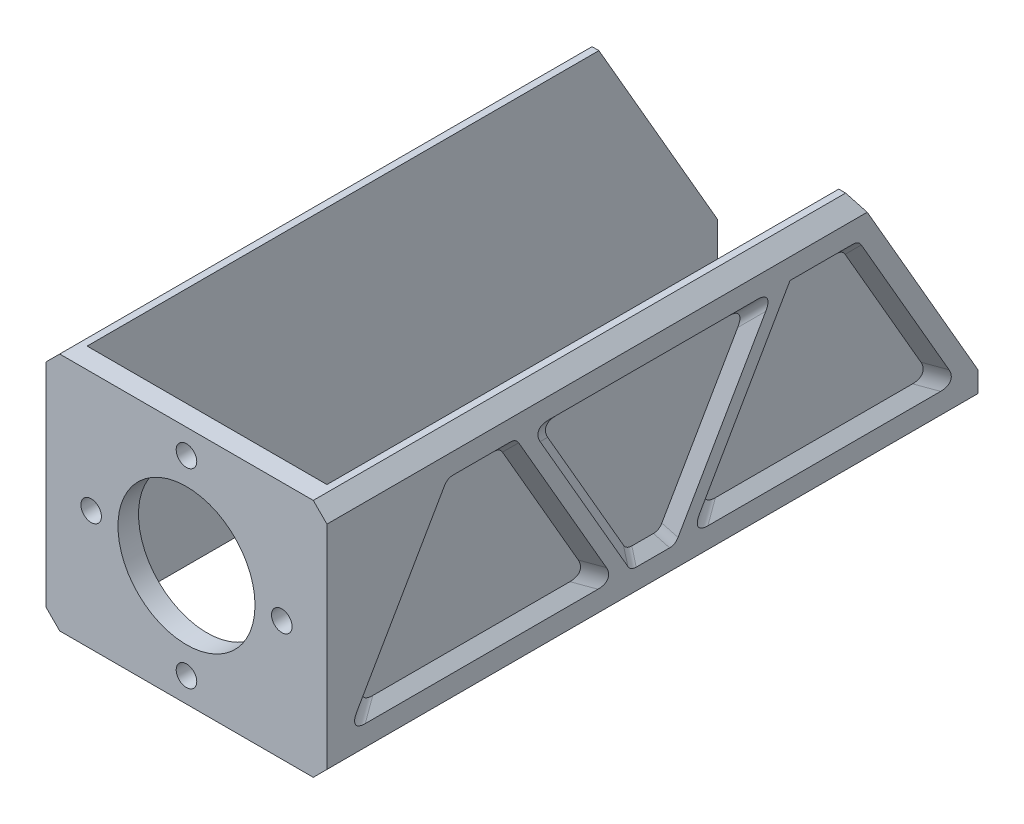
from build123d import *

# Parameters (mm, degrees)
SKETCH1_W           = 35
SKETCH1_H           = 35
BOSS_EXTRUDE1_DEPTH = 3
SKETCH2_R           = 10
CUT_EXTRUDE1_DEPTH  = 50.588305073
SKETCH4_W           = 95
SKETCH4_H           = 35
BOSS_EXTRUDE2_DEPTH = 3
SKETCH6_W           = 95
SKETCH6_H           = 35
BOSS_EXTRUDE5_DEPTH = 3
CHAMFER1_SIZE       = 2
CUT_EXTRUDE3_DEPTH  = 1.5
CUT_EXTRUDE4_DEPTH  = 1.5
CUT_EXTRUDE5_DEPTH  = 1.5
CHAMFER3_SIZE       = 1.5
CUT_EXTRUDE6_DEPTH  = 107.630202101
SKETCH11_R          = 1.5
CUT_EXTRUDE7_DEPTH  = 109.138799697
FILLET3_R           = 2


# Some blends are built 0.0001 mm under size
with BuildPart() as part:
    # Sketch1 → Boss-Extrude1 (new body)
    with BuildSketch(Plane.XY):
        with Locations((17.5, 17.5)):
            Rectangle(SKETCH1_W, SKETCH1_H)
    extrude(amount=BOSS_EXTRUDE1_DEPTH)

    # Sketch2 → Cut-Extrude1 (cut, through all)
    with BuildSketch(Plane.XY.offset(3)):
        with Locations((17.5, 17.5)):
            Circle(SKETCH2_R)
    extrude(amount=-CUT_EXTRUDE1_DEPTH, mode=Mode.SUBTRACT)

    # Sketch4 → Boss-Extrude2 (add)
    with BuildSketch(Plane.ZY):
        with Locations((-44.5, 17.5)):
            Rectangle(SKETCH4_W, SKETCH4_H)
    extrude(amount=BOSS_EXTRUDE2_DEPTH)

    # Sketch6 → Boss-Extrude5 (add)
    with BuildSketch(Plane(origin=(35, 0, 0), x_dir=(0, 0, -1), z_dir=(1, 0, 0))):
        with Locations((44.5, 17.5)):
            Rectangle(SKETCH6_W, SKETCH6_H)
    extrude(amount=BOSS_EXTRUDE5_DEPTH)

    # Chamfer1
    chamfer1_edges = [part.edges().sort_by_distance(p)[0] for p in [
        (-3, 35, -44.5),
        (-3, 0, -44.5),
        (38, 0, -44.5),
        (38, 35, -44.5),
    ]]
    chamfer(chamfer1_edges, length=CHAMFER1_SIZE)

    # Sketch7 → Cut-Extrude3 (cut)
    with BuildSketch(Plane.ZY.offset(3)):
        Polygon((-89, 5), (-50.132486541, 5), (-64.56624327, 30), (-74.56624327, 30), align=None)
        Polygon((-39, 5), (-24.56624327, 30), (-14.56624327, 30), (-0.132486541, 5), align=None)
    extrude(amount=-CUT_EXTRUDE3_DEPTH, mode=Mode.SUBTRACT)

    # Sketch8 → Cut-Extrude4 (cut)
    with BuildSketch(Plane.ZY.offset(3)):
        Polygon((-47.823085464, 5), (-41.309401077, 5), (-26.875644347, 30), (-62.256842194, 30), align=None)
    extrude(amount=-CUT_EXTRUDE4_DEPTH, mode=Mode.SUBTRACT)

    # Sketch9 → Cut-Extrude5 (cut)
    with BuildSketch(Plane(origin=(38, 0, 0), x_dir=(0, 0, -1), z_dir=(1, 0, 0))):
        Polygon((0.132486541, 5), (14.56624327, 30), (24.56624327, 30), (39, 5), align=None)
        Polygon((41.309401077, 5), (47.823085464, 5), (62.256842194, 30), (26.875644347, 30), align=None)
        Polygon((50.132486541, 5), (89, 5), (74.56624327, 30), (64.56624327, 30), align=None)
    extrude(amount=-CUT_EXTRUDE5_DEPTH, mode=Mode.SUBTRACT)

    # Chamfer3
    chamfer3_edges = [part.edges().sort_by_distance(p)[0] for p in [
        (-1.5, 17.5, -31.783121635),
        (-1.5, 30, -19.56624327),
        (-1.5, 17.5, -7.349364905),
        (-1.5, 5, -19.56624327),
        (-1.5, 30, -44.56624327),
        (-1.5, 17.5, -34.092522712),
        (-1.5, 5, -44.56624327),
        (-1.5, 17.5, -55.039963829),
        (-1.5, 30, -69.56624327),
        (-1.5, 17.5, -57.349364905),
        (-1.5, 5, -69.56624327),
        (-1.5, 17.5, -81.783121635),
        (36.5, 30, -69.56624327),
        (36.5, 17.5, -81.783121635),
        (36.5, 5, -69.56624327),
        (36.5, 17.5, -57.349364905),
        (36.5, 30, -44.56624327),
        (36.5, 17.5, -55.039963829),
        (36.5, 5, -44.56624327),
        (36.5, 17.5, -34.092522712),
        (36.5, 17.5, -7.349364905),
        (36.5, 30, -19.56624327),
        (36.5, 17.5, -31.783121635),
        (36.5, 5, -19.56624327),
    ]]
    chamfer(chamfer3_edges, length=CHAMFER3_SIZE - 0.0001)  # a hair under: the kernel refuses the full size

    # Sketch10 → Cut-Extrude6 (cut, through all)
    with BuildSketch(Plane.ZY.offset(3)):
        Polygon((-92, 5), (-74.679491924, 35), (-92, 35), align=None)
    extrude(amount=-CUT_EXTRUDE6_DEPTH, mode=Mode.SUBTRACT)

    # Sketch11 → Cut-Extrude7 (cut, through all)
    with BuildSketch(Plane.XY.offset(3)):
        with Locations((17.5, 31.41)):
            Circle(SKETCH11_R)
        with Locations((31.41, 17.5)):
            Circle(SKETCH11_R)
        with Locations((17.5, 3.59)):
            Circle(SKETCH11_R)
        with Locations((3.59, 17.5)):
            Circle(SKETCH11_R)
    extrude(amount=-CUT_EXTRUDE7_DEPTH, mode=Mode.SUBTRACT)

    # Fillet3
    # the kernel refuses this fillet: 2 mm, written as the material it adds along each edge
    with BuildSketch(Plane(origin=(-4.237079148, 31.237179148, -13.851957556), x_dir=(-0.26726124191242534, -0.6681531047810635, 0.6943650748294108), z_dir=(0.6546536707079771, -0.6546536707079762, -0.37796447300922925))) as fillet3_piece_1_section:
        with BuildLine():
            CenterArc((FILLET3_R * 0.377964473009, FILLET3_R), FILLET3_R, 228.590377891, 41.409622109)
            Line((-FILLET3_R * 0.283473354757, FILLET3_R * 0.25), (0, 0))
            Line((0, 0), (FILLET3_R * 0.377964473009, 0))
        make_face()
    fillet3_piece_1 = extrude(amount=6.070779825, mode=Mode.PRIVATE)
    fillet3_piece_1 = split(fillet3_piece_1, bisect_by=Plane(origin=(-3, 30.0000375, -14.56622162), z_dir=(1, 0, 0)), keep=Keep.TOP, mode=Mode.PRIVATE)
    add(fillet3_piece_1)
    with BuildSketch(Plane(origin=(-4.731950808, 3.267949192, 2.867513459), x_dir=(-0.5477225575051657, -0.5477225575051657, -0.6324555320336765), z_dir=(0.4472135954999585, 0.4472135954999585, -0.7745966692414828))) as fillet3_piece_2_section:
        with BuildLine():
            CenterArc((FILLET3_R * 0.774596669241, FILLET3_R), FILLET3_R, 194.477512186, 75.522487814)
            Line((-FILLET3_R * 0.19364916731, FILLET3_R * 0.75), (0, 0))
            Line((0, 0), (FILLET3_R * 0.774596669241, 0))
        make_face()
    fillet3_piece_2 = extrude(amount=11.099845052, mode=Mode.PRIVATE)
    fillet3_piece_2 = split(fillet3_piece_2, bisect_by=Plane(origin=(-3, 6.208026651, -2.224850076), z_dir=(1, 0, 0)), keep=Keep.TOP, mode=Mode.PRIVATE)
    fillet3_piece_2 = split(fillet3_piece_2, bisect_by=Plane(origin=(-1.5, 6.208026651, -2.224850076), z_dir=(-1, 0, 0)), keep=Keep.TOP, mode=Mode.PRIVATE)
    add(fillet3_piece_2)
    with BuildSketch(Plane(origin=(-4.237079148, 31.237179148, -25.280528985), x_dir=(-0.2672612419124285, -0.6681531047810648, -0.6943650748294081), z_dir=(0.6546536707079759, -0.6546536707079768, 0.3779644730092301))) as fillet3_piece_3_section:
        with BuildLine():
            CenterArc((FILLET3_R * 0.377964473009, -FILLET3_R), FILLET3_R, 90, 41.409622109)
            Line((-FILLET3_R * 0.283473354757, -FILLET3_R * 0.25), (0, 0))
            Line((0, 0), (FILLET3_R * 0.377964473009, 0))
        make_face()
    fillet3_piece_3 = extrude(amount=6.070779825, mode=Mode.PRIVATE)
    fillet3_piece_3 = split(fillet3_piece_3, bisect_by=Plane(origin=(-3, 30.0000375, -24.566264921), z_dir=(1, 0, 0)), keep=Keep.TOP, mode=Mode.PRIVATE)
    add(fillet3_piece_3)
    with BuildSketch(Plane(origin=(-4.731950808, 3.267949192, -42), x_dir=(-0.5477225575051646, -0.5477225575051644, 0.6324555320336788), z_dir=(0.44721359549996004, 0.44721359549996004, 0.7745966692414811))) as fillet3_piece_4_section:
        with BuildLine():
            CenterArc((FILLET3_R * 0.774596669241, -FILLET3_R), FILLET3_R, 90, 75.522487814)
            Line((-FILLET3_R * 0.19364916731, -FILLET3_R * 0.75), (0, 0))
            Line((0, 0), (FILLET3_R * 0.774596669241, 0))
        make_face()
    fillet3_piece_4 = extrude(amount=11.099845052, mode=Mode.PRIVATE)
    fillet3_piece_4 = split(fillet3_piece_4, bisect_by=Plane(origin=(-3, 6.208026651, -36.907636464), z_dir=(1, 0, 0)), keep=Keep.TOP, mode=Mode.PRIVATE)
    fillet3_piece_4 = split(fillet3_piece_4, bisect_by=Plane(origin=(-1.5, 6.208026651, -36.907636464), z_dir=(-1, 0, 0)), keep=Keep.TOP, mode=Mode.PRIVATE)
    add(fillet3_piece_4)
    with BuildSketch(Plane(origin=(-4.237079148, 3.762820852, -40.595115362), x_dir=(-0.26726124191242456, -0.26726124191242456, -0.9258200997725514), z_dir=(0.6546536707079772, 0.6546536707079771, -0.3779644730092275))) as fillet3_piece_5_section:
        with BuildLine():
            CenterArc((FILLET3_R * 0.377964473009, FILLET3_R), FILLET3_R, 228.590377891, 41.409622109)
            Line((-FILLET3_R * 0.283473354757, FILLET3_R * 0.25), (0, 0))
            Line((0, 0), (FILLET3_R * 0.377964473009, 0))
        make_face()
    fillet3_piece_5 = extrude(amount=6.070779825, mode=Mode.PRIVATE)
    fillet3_piece_5 = split(fillet3_piece_5, bisect_by=Plane(origin=(-3, 4.9999625, -41.309379426), z_dir=(1, 0, 0)), keep=Keep.TOP, mode=Mode.PRIVATE)
    add(fillet3_piece_5)
    with BuildSketch(Plane(origin=(-4.237079148, 3.762820852, -48.537371178), x_dir=(-0.26726124191242456, -0.267261241912424, 0.9258200997725515), z_dir=(0.6546536707079772, 0.6546536707079773, 0.37796447300922714))) as fillet3_piece_6_section:
        with BuildLine():
            CenterArc((FILLET3_R * 0.377964473009, -FILLET3_R), FILLET3_R, 90, 41.409622109)
            Line((-FILLET3_R * 0.283473354757, -FILLET3_R * 0.25), (0, 0))
            Line((0, 0), (FILLET3_R * 0.377964473009, 0))
        make_face()
    fillet3_piece_6 = extrude(amount=6.070779825, mode=Mode.PRIVATE)
    fillet3_piece_6 = split(fillet3_piece_6, bisect_by=Plane(origin=(-3, 4.9999625, -47.823107114), z_dir=(1, 0, 0)), keep=Keep.TOP, mode=Mode.PRIVATE)
    add(fillet3_piece_6)
    with BuildSketch(Plane(origin=(-4.731950808, 31.732050808, -23.875644347), x_dir=(-0.5477225575051662, -0.8215838362577491, 0.1581138830084191), z_dir=(0.44721359549995787, -0.44721359549995815, -0.7745966692414833))) as fillet3_piece_7_section:
        with BuildLine():
            CenterArc((FILLET3_R * 0.774596669241, FILLET3_R), FILLET3_R, 194.477512186, 75.522487814)
            Line((-FILLET3_R * 0.19364916731, FILLET3_R * 0.75), (0, 0))
            Line((0, 0), (FILLET3_R * 0.774596669241, 0))
        make_face()
    fillet3_piece_7 = extrude(amount=11.099845052, mode=Mode.PRIVATE)
    fillet3_piece_7 = split(fillet3_piece_7, bisect_by=Plane(origin=(-3, 28.791973349, -28.968007883), z_dir=(1, 0, 0)), keep=Keep.TOP, mode=Mode.PRIVATE)
    fillet3_piece_7 = split(fillet3_piece_7, bisect_by=Plane(origin=(0, 28.791973349, -28.968007883), z_dir=(-1, 0, 0)), keep=Keep.TOP, mode=Mode.PRIVATE)
    add(fillet3_piece_7)
    with BuildSketch(Plane(origin=(-4.731950808, 31.732050808, -65.256842194), x_dir=(-0.5477225575051665, -0.821583836257749, -0.15811388300841855), z_dir=(0.4472135954999584, -0.44721359549995815, 0.7745966692414831))) as fillet3_piece_8_section:
        with BuildLine():
            CenterArc((FILLET3_R * 0.774596669241, -FILLET3_R), FILLET3_R, 90, 75.522487814)
            Line((-FILLET3_R * 0.19364916731, -FILLET3_R * 0.75), (0, 0))
            Line((0, 0), (FILLET3_R * 0.774596669241, 0))
        make_face()
    fillet3_piece_8 = extrude(amount=11.099845052, mode=Mode.PRIVATE)
    fillet3_piece_8 = split(fillet3_piece_8, bisect_by=Plane(origin=(-3, 28.791973349, -60.164478658), z_dir=(1, 0, 0)), keep=Keep.TOP, mode=Mode.PRIVATE)
    fillet3_piece_8 = split(fillet3_piece_8, bisect_by=Plane(origin=(0, 28.791973349, -60.164478658), z_dir=(-1, 0, 0)), keep=Keep.TOP, mode=Mode.PRIVATE)
    add(fillet3_piece_8)
    with BuildSketch(Plane(origin=(-4.731950808, 3.267949192, -47.132486541), x_dir=(-0.5477225575051652, -0.5477225575051655, -0.6324555320336772), z_dir=(0.4472135954999589, 0.447213595499959, -0.7745966692414823))) as fillet3_piece_9_section:
        with BuildLine():
            CenterArc((FILLET3_R * 0.774596669241, FILLET3_R), FILLET3_R, 194.477512186, 75.522487814)
            Line((-FILLET3_R * 0.19364916731, FILLET3_R * 0.75), (0, 0))
            Line((0, 0), (FILLET3_R * 0.774596669241, 0))
        make_face()
    fillet3_piece_9 = extrude(amount=11.099845052, mode=Mode.PRIVATE)
    fillet3_piece_9 = split(fillet3_piece_9, bisect_by=Plane(origin=(-3, 6.208026651, -52.224850076), z_dir=(1, 0, 0)), keep=Keep.TOP, mode=Mode.PRIVATE)
    fillet3_piece_9 = split(fillet3_piece_9, bisect_by=Plane(origin=(-1.5, 6.208026651, -52.224850076), z_dir=(-1, 0, 0)), keep=Keep.TOP, mode=Mode.PRIVATE)
    add(fillet3_piece_9)
    with BuildSketch(Plane(origin=(-4.731950808, 3.267949192, -92), x_dir=(-0.5477225575051636, -0.5477225575051639, 0.63245553203368), z_dir=(0.4472135954999609, 0.44721359549996087, 0.7745966692414801))) as fillet3_piece_10_section:
        with BuildLine():
            CenterArc((FILLET3_R * 0.774596669241, -FILLET3_R), FILLET3_R, 90, 75.522487814)
            Line((-FILLET3_R * 0.19364916731, -FILLET3_R * 0.75), (0, 0))
            Line((0, 0), (FILLET3_R * 0.774596669241, 0))
        make_face()
    fillet3_piece_10 = extrude(amount=11.099845052, mode=Mode.PRIVATE)
    fillet3_piece_10 = split(fillet3_piece_10, bisect_by=Plane(origin=(-3, 6.208026651, -86.907636464), z_dir=(1, 0, 0)), keep=Keep.TOP, mode=Mode.PRIVATE)
    fillet3_piece_10 = split(fillet3_piece_10, bisect_by=Plane(origin=(-1.5, 6.208026651, -86.907636464), z_dir=(-1, 0, 0)), keep=Keep.TOP, mode=Mode.PRIVATE)
    add(fillet3_piece_10)
    with BuildSketch(Plane(origin=(-4.237079148, 31.237179148, -63.851957556), x_dir=(-0.2672612419124199, -0.6681531047810638, 0.6943650748294127), z_dir=(0.6546536707079784, -0.6546536707079738, -0.377964473009231))) as fillet3_piece_11_section:
        with BuildLine():
            CenterArc((FILLET3_R * 0.377964473009, FILLET3_R), FILLET3_R, 228.590377891, 41.409622109)
            Line((-FILLET3_R * 0.283473354757, FILLET3_R * 0.25), (0, 0))
            Line((0, 0), (FILLET3_R * 0.377964473009, 0))
        make_face()
    fillet3_piece_11 = extrude(amount=6.070779825, mode=Mode.PRIVATE)
    fillet3_piece_11 = split(fillet3_piece_11, bisect_by=Plane(origin=(-3, 30.0000375, -64.56622162), z_dir=(1, 0, 0)), keep=Keep.TOP, mode=Mode.PRIVATE)
    add(fillet3_piece_11)
    with BuildSketch(Plane(origin=(-4.237079148, 31.237179148, -75.280528985), x_dir=(-0.2672612419124319, -0.6681531047810608, -0.6943650748294108), z_dir=(0.6546536707079755, -0.6546536707079802, 0.37796447300922503))) as fillet3_piece_12_section:
        with BuildLine():
            CenterArc((FILLET3_R * 0.377964473009, -FILLET3_R), FILLET3_R, 90, 41.409622109)
            Line((-FILLET3_R * 0.283473354757, -FILLET3_R * 0.25), (0, 0))
            Line((0, 0), (FILLET3_R * 0.377964473009, 0))
        make_face()
    fillet3_piece_12 = extrude(amount=6.070779825, mode=Mode.PRIVATE)
    fillet3_piece_12 = split(fillet3_piece_12, bisect_by=Plane(origin=(-3, 30.0000375, -74.566264921), z_dir=(1, 0, 0)), keep=Keep.TOP, mode=Mode.PRIVATE)
    add(fillet3_piece_12)
    with BuildSketch(Plane(origin=(39.731950808, 3.267949192, -92), x_dir=(0.547722557505162, -0.5477225575051657, 0.6324555320336798), z_dir=(-0.44721359549996026, 0.44721359549996115, 0.7745966692414803))) as fillet3_piece_13_section:
        with BuildLine():
            CenterArc((FILLET3_R * 0.774596669241, FILLET3_R), FILLET3_R, 194.477512186, 75.522487814)
            Line((-FILLET3_R * 0.19364916731, FILLET3_R * 0.75), (0, 0))
            Line((0, 0), (FILLET3_R * 0.774596669241, 0))
        make_face()
    fillet3_piece_13 = extrude(amount=11.099845052, mode=Mode.PRIVATE)
    fillet3_piece_13 = split(fillet3_piece_13, bisect_by=Plane(origin=(38, 6.208026651, -86.907636464), z_dir=(-1, 0, 0)), keep=Keep.TOP, mode=Mode.PRIVATE)
    fillet3_piece_13 = split(fillet3_piece_13, bisect_by=Plane(origin=(36.5, 6.208026651, -86.907636464), z_dir=(1, 0, 0)), keep=Keep.TOP, mode=Mode.PRIVATE)
    add(fillet3_piece_13)
    with BuildSketch(Plane(origin=(39.731950808, 3.267949192, -47.132486541), x_dir=(0.5477225575051635, 0.8215838362577502, 0.15811388300842216), z_dir=(-0.4472135954999577, 0.44721359549995876, -0.7745966692414832))) as fillet3_piece_14_section:
        with BuildLine():
            CenterArc((FILLET3_R * 0.774596669241, FILLET3_R), FILLET3_R, 194.477512186, 75.522487814)
            Line((-FILLET3_R * 0.19364916731, FILLET3_R * 0.75), (0, 0))
            Line((0, 0), (FILLET3_R * 0.774596669241, 0))
        make_face()
    fillet3_piece_14 = extrude(amount=11.099845052, mode=Mode.PRIVATE)
    fillet3_piece_14 = split(fillet3_piece_14, bisect_by=Plane(origin=(38, 6.208026651, -52.224850076), z_dir=(-1, 0, 0)), keep=Keep.TOP, mode=Mode.PRIVATE)
    fillet3_piece_14 = split(fillet3_piece_14, bisect_by=Plane(origin=(36.5, 6.208026651, -52.224850076), z_dir=(1, 0, 0)), keep=Keep.TOP, mode=Mode.PRIVATE)
    add(fillet3_piece_14)
    with BuildSketch(Plane(origin=(39.237079148, 31.237179148, -75.280528985), x_dir=(0.2672612419124258, 0.26726124191242107, 0.9258200997725521), z_dir=(-0.654653670707975, -0.6546536707079802, 0.3779644730092258))) as fillet3_piece_15_section:
        with BuildLine():
            CenterArc((FILLET3_R * 0.377964473009, -FILLET3_R), FILLET3_R, 90, 41.409622109)
            Line((-FILLET3_R * 0.283473354757, -FILLET3_R * 0.25), (0, 0))
            Line((0, 0), (FILLET3_R * 0.377964473009, 0))
        make_face()
    fillet3_piece_15 = extrude(amount=6.070779825, mode=Mode.PRIVATE)
    fillet3_piece_15 = split(fillet3_piece_15, bisect_by=Plane(origin=(38, 30.0000375, -74.566264921), z_dir=(-1, 0, 0)), keep=Keep.TOP, mode=Mode.PRIVATE)
    add(fillet3_piece_15)
    with BuildSketch(Plane(origin=(39.237079148, 3.762820852, -48.537371178), x_dir=(0.26726124191242484, -0.26726124191242484, 0.9258200997725512), z_dir=(-0.6546536707079762, 0.6546536707079778, 0.37796447300922786))) as fillet3_piece_16_section:
        with BuildLine():
            CenterArc((FILLET3_R * 0.377964473009, FILLET3_R), FILLET3_R, 228.590377891, 41.409622109)
            Line((-FILLET3_R * 0.283473354757, FILLET3_R * 0.25), (0, 0))
            Line((0, 0), (FILLET3_R * 0.377964473009, 0))
        make_face()
    fillet3_piece_16 = extrude(amount=6.070779825, mode=Mode.PRIVATE)
    fillet3_piece_16 = split(fillet3_piece_16, bisect_by=Plane(origin=(38, 4.9999625, -47.823107114), z_dir=(-1, 0, 0)), keep=Keep.TOP, mode=Mode.PRIVATE)
    add(fillet3_piece_16)
    with BuildSketch(Plane(origin=(39.237079148, 3.762820852, -40.595115362), x_dir=(0.26726124191242373, 0.66815310478106, 0.6943650748294149), z_dir=(-0.6546536707079764, 0.6546536707079779, -0.37796447300922736))) as fillet3_piece_17_section:
        with BuildLine():
            CenterArc((FILLET3_R * 0.377964473009, FILLET3_R), FILLET3_R, 228.590377891, 41.409622109)
            Line((-FILLET3_R * 0.283473354757, FILLET3_R * 0.25), (0, 0))
            Line((0, 0), (FILLET3_R * 0.377964473009, 0))
        make_face()
    fillet3_piece_17 = extrude(amount=6.070779825, mode=Mode.PRIVATE)
    fillet3_piece_17 = split(fillet3_piece_17, bisect_by=Plane(origin=(38, 4.9999625, -41.309379426), z_dir=(-1, 0, 0)), keep=Keep.TOP, mode=Mode.PRIVATE)
    add(fillet3_piece_17)
    with BuildSketch(Plane(origin=(39.731950808, 31.732050808, -65.256842194), x_dir=(0.5477225575051664, 0.5477225575051664, 0.6324555320336754), z_dir=(-0.4472135954999572, -0.44721359549995804, 0.7745966692414837))) as fillet3_piece_18_section:
        with BuildLine():
            CenterArc((FILLET3_R * 0.774596669241, -FILLET3_R), FILLET3_R, 90, 75.522487814)
            Line((-FILLET3_R * 0.19364916731, -FILLET3_R * 0.75), (0, 0))
            Line((0, 0), (FILLET3_R * 0.774596669241, 0))
        make_face()
    fillet3_piece_18 = extrude(amount=11.099845052, mode=Mode.PRIVATE)
    fillet3_piece_18 = split(fillet3_piece_18, bisect_by=Plane(origin=(38, 28.791973349, -60.164478658), z_dir=(-1, 0, 0)), keep=Keep.TOP, mode=Mode.PRIVATE)
    fillet3_piece_18 = split(fillet3_piece_18, bisect_by=Plane(origin=(36.5, 28.791973349, -60.164478658), z_dir=(1, 0, 0)), keep=Keep.TOP, mode=Mode.PRIVATE)
    add(fillet3_piece_18)
    with BuildSketch(Plane(origin=(39.731950808, 31.732050808, -23.875644347), x_dir=(0.5477225575051664, -0.8215838362577489, 0.15811388300841975), z_dir=(-0.44721359549995715, -0.4472135954999585, -0.7745966692414836))) as fillet3_piece_19_section:
        with BuildLine():
            CenterArc((FILLET3_R * 0.774596669241, -FILLET3_R), FILLET3_R, 90, 75.522487814)
            Line((-FILLET3_R * 0.19364916731, -FILLET3_R * 0.75), (0, 0))
            Line((0, 0), (FILLET3_R * 0.774596669241, 0))
        make_face()
    fillet3_piece_19 = extrude(amount=11.099845052, mode=Mode.PRIVATE)
    fillet3_piece_19 = split(fillet3_piece_19, bisect_by=Plane(origin=(38, 28.791973349, -28.968007883), z_dir=(-1, 0, 0)), keep=Keep.TOP, mode=Mode.PRIVATE)
    fillet3_piece_19 = split(fillet3_piece_19, bisect_by=Plane(origin=(36.5, 28.791973349, -28.968007883), z_dir=(1, 0, 0)), keep=Keep.TOP, mode=Mode.PRIVATE)
    add(fillet3_piece_19)
    with BuildSketch(Plane(origin=(39.237079148, 31.237179148, -25.280528985), x_dir=(0.26726124191242556, 0.26726124191242556, 0.9258200997725509), z_dir=(-0.6546536707079755, -0.654653670707978, 0.377964473009229))) as fillet3_piece_20_section:
        with BuildLine():
            CenterArc((FILLET3_R * 0.377964473009, -FILLET3_R), FILLET3_R, 90, 41.409622109)
            Line((-FILLET3_R * 0.283473354757, -FILLET3_R * 0.25), (0, 0))
            Line((0, 0), (FILLET3_R * 0.377964473009, 0))
        make_face()
    fillet3_piece_20 = extrude(amount=6.070779825, mode=Mode.PRIVATE)
    fillet3_piece_20 = split(fillet3_piece_20, bisect_by=Plane(origin=(38, 30.0000375, -24.566264921), z_dir=(-1, 0, 0)), keep=Keep.TOP, mode=Mode.PRIVATE)
    add(fillet3_piece_20)
    with BuildSketch(Plane(origin=(39.731950808, 3.267949192, -42), x_dir=(0.5477225575051637, -0.5477225575051652, 0.6324555320336785), z_dir=(-0.44721359549995937, 0.4472135954999604, 0.7745966692414812))) as fillet3_piece_21_section:
        with BuildLine():
            CenterArc((FILLET3_R * 0.774596669241, FILLET3_R), FILLET3_R, 194.477512186, 75.522487814)
            Line((-FILLET3_R * 0.19364916731, FILLET3_R * 0.75), (0, 0))
            Line((0, 0), (FILLET3_R * 0.774596669241, 0))
        make_face()
    fillet3_piece_21 = extrude(amount=11.099845052, mode=Mode.PRIVATE)
    fillet3_piece_21 = split(fillet3_piece_21, bisect_by=Plane(origin=(38, 6.208026651, -36.907636464), z_dir=(-1, 0, 0)), keep=Keep.TOP, mode=Mode.PRIVATE)
    fillet3_piece_21 = split(fillet3_piece_21, bisect_by=Plane(origin=(36.5, 6.208026651, -36.907636464), z_dir=(1, 0, 0)), keep=Keep.TOP, mode=Mode.PRIVATE)
    add(fillet3_piece_21)
    with BuildSketch(Plane(origin=(39.237079148, 31.237179148, -13.851957556), x_dir=(0.2672612419124238, -0.6681531047810619, 0.6943650748294129), z_dir=(-0.6546536707079763, -0.654653670707977, -0.3779644730092292))) as fillet3_piece_22_section:
        with BuildLine():
            CenterArc((FILLET3_R * 0.377964473009, -FILLET3_R), FILLET3_R, 90, 41.409622109)
            Line((-FILLET3_R * 0.283473354757, -FILLET3_R * 0.25), (0, 0))
            Line((0, 0), (FILLET3_R * 0.377964473009, 0))
        make_face()
    fillet3_piece_22 = extrude(amount=6.070779825, mode=Mode.PRIVATE)
    fillet3_piece_22 = split(fillet3_piece_22, bisect_by=Plane(origin=(38, 30.0000375, -14.56622162), z_dir=(-1, 0, 0)), keep=Keep.TOP, mode=Mode.PRIVATE)
    add(fillet3_piece_22)
    with BuildSketch(Plane(origin=(39.731950808, 3.267949192, 2.867513459), x_dir=(0.5477225575051679, 0.8215838362577481, 0.1581138830084184), z_dir=(-0.44721359549995776, 0.44721359549995876, -0.7745966692414831))) as fillet3_piece_23_section:
        with BuildLine():
            CenterArc((FILLET3_R * 0.774596669241, FILLET3_R), FILLET3_R, 194.477512186, 75.522487814)
            Line((-FILLET3_R * 0.19364916731, FILLET3_R * 0.75), (0, 0))
            Line((0, 0), (FILLET3_R * 0.774596669241, 0))
        make_face()
    fillet3_piece_23 = extrude(amount=11.099845052, mode=Mode.PRIVATE)
    fillet3_piece_23 = split(fillet3_piece_23, bisect_by=Plane(origin=(38, 6.208026651, -2.224850076), z_dir=(-1, 0, 0)), keep=Keep.TOP, mode=Mode.PRIVATE)
    fillet3_piece_23 = split(fillet3_piece_23, bisect_by=Plane(origin=(36.5, 6.208026651, -2.224850076), z_dir=(1, 0, 0)), keep=Keep.TOP, mode=Mode.PRIVATE)
    add(fillet3_piece_23)


solid = part.part
